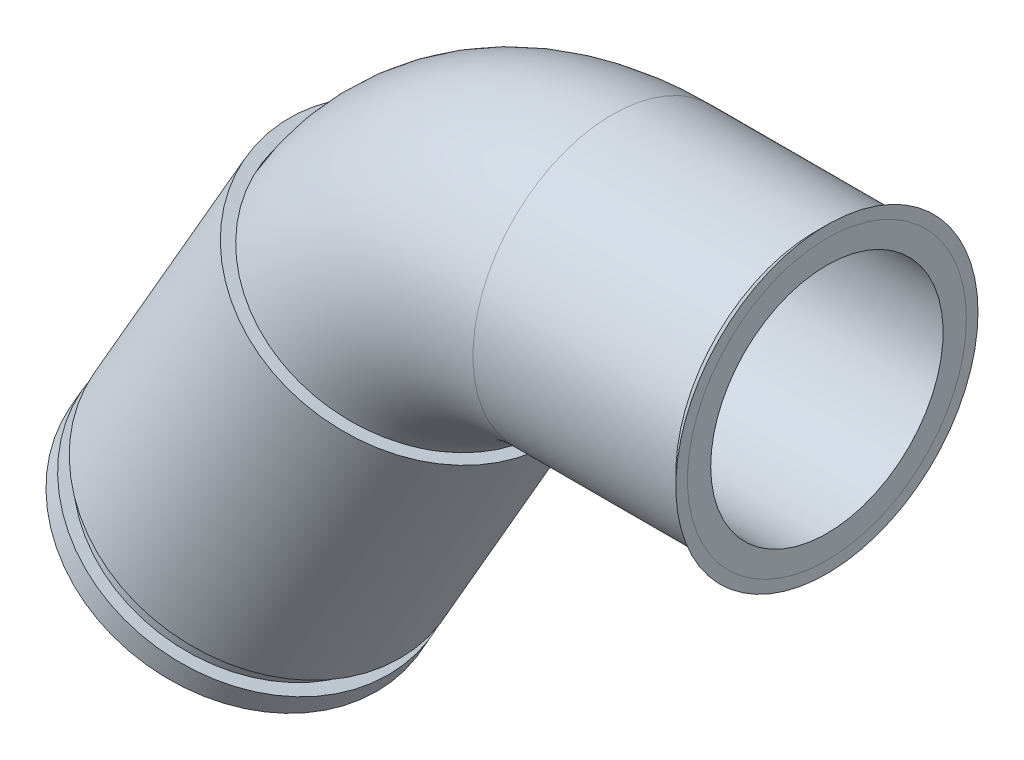
from build123d import *

# Parameters (mm, degrees)
SWEEP_THIN1_PROFILE_R   = 6
SWEEP_THIN1_PROFILE_R_2 = 5
BOSS_EXTRUDE1_START     = -15
SKETCH17_R              = 6.5
SKETCH17_R_2            = 6
BOSS_EXTRUDE1_DEPTH     = 15
CUT_EXTRUDE1_START      = -2
SKETCH17_3_R            = 6.5
SKETCH17_3_R_2          = 6
CUT_EXTRUDE1_DEPTH      = 1
SKETCH18_R              = 6.5
SKETCH18_R_2            = 6
BOSS_EXTRUDE2_DEPTH     = 1


with BuildPart() as part:
    # Sweep-Thin1: sweep along a path in Sketch1
    with BuildLine(Plane.XY) as sweep_thin1_path:
        Line((-10, -17.320508076), (-2.886751346, -5))
        ThreePointArc((-2.886751346, -5), (0.773502692, -1.339745962), (5.773502692, 0))
        Line((5.773502692, 0), (15, 0))
    # Sweep-Thin1 profile (on start of the path) → Sweep-Thin1 (sweep)
    with BuildSketch(Plane(origin=(-10, -17.320508076, 0), x_dir=(0.8660254037844363, -0.5000000000000041, 0), z_dir=(0.5000000000000041, 0.8660254037844363, 0))):
        Circle(SWEEP_THIN1_PROFILE_R)
        Circle(SWEEP_THIN1_PROFILE_R_2, mode=Mode.SUBTRACT)
    sweep(path=sweep_thin1_path.line)

    # Sketch17 → Boss-Extrude1 (add)
    with BuildSketch(Plane(origin=(-10, -17.320508076, 0), x_dir=(0.8660254037844363, -0.5000000000000042, 0), z_dir=(-0.5000000000000041, -0.8660254037844362, 0)).offset(BOSS_EXTRUDE1_START)):
        Circle(SKETCH17_R)
        Circle(SKETCH17_R_2, mode=Mode.SUBTRACT)
    extrude(amount=BOSS_EXTRUDE1_DEPTH)

    # Sketch17<3> → Cut-Extrude1 (cut)
    with BuildSketch(Plane(origin=(-10, -17.320508076, 0), x_dir=(0.8660254037844363, -0.5000000000000042, 0), z_dir=(-0.5000000000000041, -0.8660254037844362, 0)).offset(CUT_EXTRUDE1_START)):
        Circle(SKETCH17_3_R)
        Circle(SKETCH17_3_R_2, mode=Mode.SUBTRACT)
    extrude(amount=CUT_EXTRUDE1_DEPTH, mode=Mode.SUBTRACT)


with BuildPart() as body_2:
    # Sketch18 → Boss-Extrude2 (new body)
    with BuildSketch(Plane(origin=(15, 0, 0), x_dir=(0, 0, -1), z_dir=(1, 0, 0))):
        Circle(SKETCH18_R)
        Circle(SKETCH18_R_2, mode=Mode.SUBTRACT)
    extrude(amount=-BOSS_EXTRUDE2_DEPTH)

    # Chamfer1: read off the stored shape, not the designer's step
    # Chamfer1 outline → Chamfer1 (revolve, cut)
    with BuildSketch(Plane.YX):
        Polygon((6.5, 15), (6, 14.5), (6, 14), (6.5, 14), align=None)
    revolve(axis=Axis((0, 0, 0), (1, 0, 0)), mode=Mode.SUBTRACT)


solid = Compound([part.part, body_2.part])
